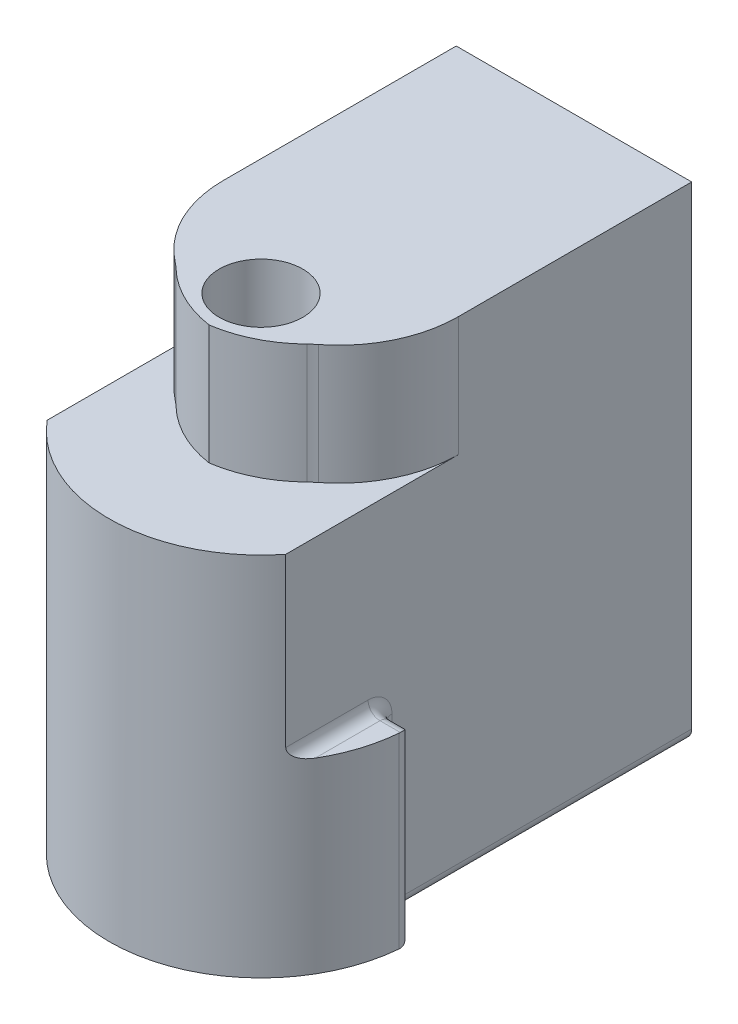
from build123d import *

# Parameters (mm, degrees)
SKETCH2_R                                      = 12.7
BOSS_EXTRUDE6_DEPTH                            = 40.64
SKETCH3_R                                      = 3.5
CUT_EXTRUDE1_DEPTH                             = 40.64
SKETCH4_R                                      = 1.778
CUT_EXTRUDE2_DEPTH                             = 6
BOSS_EXTRUDE8_DEPTH                            = 10
SKETCH8_W                                      = 25.185693912
SKETCH8_H                                      = 10
BOSS_EXTRUDE9_DEPTH                            = 7.284789049
BOSS_EXTRUDE10_DEPTH                           = 30.64
CSK_FOR_M3_FLAT_HEAD_MACHINE_SCREW1_AT_2_COUNT = 2
CSK_FOR_M3_FLAT_HEAD_MACHINE_SCREW1_AT_2_PITCH = 9.039543014
CSK_FOR_M3_FLAT_HEAD_MACHINE_SCREW1_AT_3_COUNT = 2
CSK_FOR_M3_FLAT_HEAD_MACHINE_SCREW1_AT_3_PITCH = 9.039543014
SKETCH16_W                                     = 3.769994858
SKETCH16_H                                     = 22.000968128
CUT_EXTRUDE3_DEPTH                             = 25
SKETCH17_W                                     = 10.276759259
SKETCH17_H                                     = 15.64
CUT_EXTRUDE4_DEPTH                             = 2.743753899
SKETCH18_W                                     = 12.6
SKETCH18_H                                     = 15.64
CUT_EXTRUDE5_DEPTH                             = 2.743753899
SKETCH20_W                                     = 2.743753899
SKETCH20_H                                     = 13.478747573
CUT_EXTRUDE7_DEPTH                             = 25
SKETCH21_W                                     = 5.741451758
SKETCH21_H                                     = 11.696500392
SKETCH21_W_2                                   = 5.938790765
BOSS_EXTRUDE12_DEPTH                           = 15
CUT_EXTRUDE8_START                             = -10
CUT_EXTRUDE8_DEPTH                             = 10
FILLET1_R                                      = 10
FILLET5_R                                      = 10
SKETCH23_W                                     = 2.743753899
SKETCH23_H                                     = 13.478747573
CUT_EXTRUDE9_DEPTH                             = 20
SKETCH24_W                                     = 5.557541457
SKETCH24_H                                     = 9.320824694
SKETCH24_W_2                                   = 5.259690838
BOSS_EXTRUDE13_DEPTH                           = 20
FILLET6_R                                      = 1


with BuildPart() as part:
    # Sketch2 → Boss-Extrude6 (new body)
    with BuildSketch(Plane(origin=(0, -2111.389926236, 0), x_dir=(1, 0, 0), z_dir=(0, 1, 0))):
        with Locations(Location((-53.693967541, 163.840329354, 0), (0, 0, 180))):
            Circle(SKETCH2_R)
    extrude(amount=BOSS_EXTRUDE6_DEPTH)

    # Sketch3 → Cut-Extrude1 (cut)
    with BuildSketch(Plane(origin=(0, -2070.749926236, 0), x_dir=(1, 0, 0), z_dir=(0, 1, 0))):
        with Locations(Location((-53.693967541, 163.840329354, 0), (0, 0, 270))):
            Circle(SKETCH3_R)
    extrude(amount=-CUT_EXTRUDE1_DEPTH, mode=Mode.SUBTRACT)

    # Sketch4 → Cut-Extrude2 (cut)
    with BuildSketch(Plane.XZ.offset(2111.389926236)):
        with Locations(Location((-61.942859512, -159.077829354, 0), (0, 0, 270))):
            Circle(SKETCH4_R)
        with Locations(Location((-53.693967541, -173.365329354, 0), (0, 0, 270))):
            Circle(SKETCH4_R)
        with Locations(Location((-45.44507557, -159.077829354, 0), (0, 0, 270))):
            Circle(SKETCH4_R)
    extrude(amount=-CUT_EXTRUDE2_DEPTH, mode=Mode.SUBTRACT)

    # Sketch7 → Boss-Extrude8 (add)
    with BuildSketch(Plane.XZ.offset(2111.389926236)):
        with BuildLine():
            Line((-40.993967541, -163.840329354), (-40.993967541, -182.634287878))
            Line((-40.993967541, -182.634287878), (-66.179661453, -182.634287878))
            Line((-66.179661453, -182.634287878), (-66.179661453, -166.163570095))
            ThreePointArc((-66.179661453, -166.163570095), (-52.527415502, -176.486639343), (-40.993967541, -163.840329354))
        make_face()
    extrude(amount=-BOSS_EXTRUDE8_DEPTH)

    # Sketch8 → Boss-Extrude9 (add)
    with BuildSketch(Plane(origin=(0, 0, -182.634287878), x_dir=(-1, 0, 0), z_dir=(0, 0, -1))):
        with Locations((53.586814497, -2106.389926236)):
            Rectangle(SKETCH8_W, SKETCH8_H)
    extrude(amount=BOSS_EXTRUDE9_DEPTH)

    # Sketch9 → Boss-Extrude10 (add)
    with BuildSketch(Plane(origin=(0, -2070.749926236, 0), x_dir=(1, 0, 0), z_dir=(0, 1, 0))):
        with BuildLine():
            Line((-66.179661453, 163.840329354), (-66.179661453, 189.919076927))
            Line((-66.179661453, 189.919076927), (-40.993967541, 189.919076927))
            Line((-40.993967541, 189.919076927), (-40.993967541, 163.840329354))
            ThreePointArc((-40.993967541, 163.840329354), (-53.586814497, 176.43317631), (-66.179661453, 163.840329354))
        make_face()
    extrude(amount=-BOSS_EXTRUDE10_DEPTH)

    # Sketch15 → CSK for M3 Flat Head Machine Screw1 (revolve, cut)
    with BuildSketch(Plane(origin=(-53.586814498, -2075.749926236, -189.919076927), x_dir=(0, 1, 0), z_dir=(1, 0, 0))):
        Polygon((0, 0), (0, 10), (1.7, 8.978536948), (1.7, 1.45), (3.15, 0), align=None)
    csk_for_m3_flat_head_machine_screw1 = revolve(axis=Axis((-53.586814498, -2075.749926236, -196.269076927), (0, 0, 1)), mode=Mode.SUBTRACT)

    # CSK for M3 Flat Head Machine Screw1 at 2: CSK for M3 Flat Head Machine Screw1 ×2
    with Locations(*[(-i * CSK_FOR_M3_FLAT_HEAD_MACHINE_SCREW1_AT_2_PITCH, 0, 0) for i in range(1, CSK_FOR_M3_FLAT_HEAD_MACHINE_SCREW1_AT_2_COUNT)]):
        add(csk_for_m3_flat_head_machine_screw1, mode=Mode.SUBTRACT)

    # CSK for M3 Flat Head Machine Screw1 at 3: CSK for M3 Flat Head Machine Screw1 ×2
    with Locations(*[(i * CSK_FOR_M3_FLAT_HEAD_MACHINE_SCREW1_AT_3_PITCH, 0, 0) for i in range(1, CSK_FOR_M3_FLAT_HEAD_MACHINE_SCREW1_AT_3_COUNT)]):
        add(csk_for_m3_flat_head_machine_screw1, mode=Mode.SUBTRACT)

    # Mirror1: CSK for M3 Flat Head Machine Screw1 across plane
    add(csk_for_m3_flat_head_machine_screw1.mirror(Plane.ZX.offset(-2091.069926234)), mode=Mode.SUBTRACT)

    # Mirror1 copy 1 sketch → Mirror1 copy 1 (revolve, cut)
    with BuildSketch(Plane(origin=(-62.626357512, -2106.389926232, -189.919076927), x_dir=(0, -1, 0), z_dir=(1, 0, 0))):
        Polygon((0, 0), (0, -10), (1.7, -8.978536948), (1.7, -1.45), (3.15, 0), align=None)
    revolve(axis=Axis((-62.626357512, -2106.389926232, -196.269076927), (0, 0, -1)), mode=Mode.SUBTRACT)

    # Mirror1 copy 2 sketch → Mirror1 copy 2 (revolve, cut)
    with BuildSketch(Plane(origin=(-44.547271484, -2106.389926232, -189.919076927), x_dir=(0, -1, 0), z_dir=(1, 0, 0))):
        Polygon((0, 0), (0, -10), (1.7, -8.978536948), (1.7, -1.45), (3.15, 0), align=None)
    revolve(axis=Axis((-44.547271484, -2106.389926232, -196.269076927), (0, 0, -1)), mode=Mode.SUBTRACT)

    # Sketch16 → Cut-Extrude3 (cut)
    with BuildSketch(Plane(origin=(0, -2070.749926236, 0), x_dir=(1, 0, 0), z_dir=(0, 1, 0))):
        with Locations((-65.320904983, 165.43984529)):
            Rectangle(SKETCH16_W, SKETCH16_H)
        with Locations((-41.852724011, 165.43984529)):
            Rectangle(SKETCH16_W, SKETCH16_H)
    extrude(amount=-CUT_EXTRUDE3_DEPTH, mode=Mode.SUBTRACT)

    # Sketch17 → Cut-Extrude4 (cut)
    with BuildSketch(Plane.ZY.offset(66.179661453)):
        with Locations((-171.301949724, -2103.569926236)):
            Rectangle(SKETCH17_W, SKETCH17_H)
    extrude(amount=-CUT_EXTRUDE4_DEPTH, mode=Mode.SUBTRACT)

    # Sketch18 → Cut-Extrude5 (cut)
    with BuildSketch(Plane(origin=(-40.993967541, 0, 0), x_dir=(0, 0, -1), z_dir=(1, 0, 0))):
        with Locations((170.140329354, -2103.569926236)):
            Rectangle(SKETCH18_W, SKETCH18_H)
    extrude(amount=-CUT_EXTRUDE5_DEPTH, mode=Mode.SUBTRACT)

    # Sketch20 → Cut-Extrude7 (cut)
    with BuildSketch(Plane(origin=(0, -2070.749926236, 0), x_dir=(1, 0, 0), z_dir=(0, 1, 0))):
        with Locations((-42.365844491, 183.179703141)):
            Rectangle(SKETCH20_W, SKETCH20_H)
        with Locations((-64.807784504, 183.179703141)):
            Rectangle(SKETCH20_W, SKETCH20_H)
    extrude(amount=-CUT_EXTRUDE7_DEPTH, mode=Mode.SUBTRACT)

    # Sketch21 → Boss-Extrude12 (add)
    with BuildSketch(Plane(origin=(0, 0, -189.919076927), x_dir=(-1, 0, 0), z_dir=(0, 0, -1))):
        with Locations((46.608447319, -2076.598176432)):
            Rectangle(SKETCH21_W, SKETCH21_H)
        with Locations((60.466512171, -2076.598176432)):
            Rectangle(SKETCH21_W_2, SKETCH21_H)
    extrude(amount=-BOSS_EXTRUDE12_DEPTH)

    # Sketch22 → Cut-Extrude8 (cut)
    with BuildSketch(Plane(origin=(0, -2070.749926236, 0), x_dir=(1, 0, 0), z_dir=(0, 1, 0)).offset(CUT_EXTRUDE8_START)):
        with BuildLine():
            Line((-49.74995705, 159.255687351), (-53.693967541, 159.255687351))
            Line((-53.693967541, 159.255687351), (-57.324101589, 159.255687351))
            ThreePointArc((-57.324101589, 159.255687351), (-59.615792554, 162.566782678), (-63.435907554, 163.840329354))
            Line((-63.435907554, 163.840329354), (-63.435907554, 159.255687351))
            Line((-63.435907554, 159.255687351), (-63.435907554, 155.692654546))
            ThreePointArc((-63.435907554, 155.692654546), (-53.52421717, 151.141463861), (-43.73772144, 155.95596739))
            Line((-43.73772144, 155.95596739), (-43.73772144, 159.255687351))
            Line((-43.73772144, 159.255687351), (-43.73772144, 163.840329354))
            ThreePointArc((-43.73772144, 163.840329354), (-47.518128803, 162.563400885), (-49.74995705, 159.255687351))
        make_face()
    extrude(amount=CUT_EXTRUDE8_DEPTH, mode=Mode.SUBTRACT)

    # Fillet1
    # the kernel refuses this fillet: 10 mm, written as the material it takes off along each edge
    with BuildSketch(Plane(origin=(-49.74995705, -2080.749926236, -159.255687351), x_dir=(-1, 0, 0), z_dir=(0, 1, 0))) as fillet1_piece_1:
        with BuildLine():
            CenterArc((5.294391522, -10), FILLET1_R, 90, 44.143408643)
            ThreePointArc((-1.670175142, -2.824011483), (-0.645987197, -1.523843369), (0, 0))
            Line((0, 0), (5.294391522, 0))
        make_face()
    extrude(amount=23.235978804, mode=Mode.SUBTRACT)
    with BuildSketch(Plane(origin=(-57.324101589, -2080.749926236, -159.255687351), x_dir=(1, 0, 0), z_dir=(0, 1, 0))) as fillet1_piece_2:
        with BuildLine():
            CenterArc((5.248080135, 10), FILLET1_R, 226.043798631, 43.956201369)
            ThreePointArc((-1.693002689, 2.80129392), (-0.663389254, 1.511313412), (0, 0))
            Line((0, 0), (5.248080135, 0))
        make_face()
    extrude(amount=23.120200338, mode=Mode.SUBTRACT)

    # Fillet5
    fillet5_edges = [part.edges().sort_by_distance(p)[0] for p in [
        (-43.73772144, -2075.749926236, -163.840329354),
        (-63.435907554, -2075.749926236, -163.840329354),
    ]]
    fillet(fillet5_edges, radius=FILLET5_R)

    # Sketch23 → Cut-Extrude9 (cut)
    with BuildSketch(Plane(origin=(0, -2095.749926236, 0), x_dir=(1, 0, 0), z_dir=(0, 1, 0))):
        with Locations((-64.807784504, 183.179703141)):
            Rectangle(SKETCH23_W, SKETCH23_H)
        with Locations((-42.365844491, 183.179703141)):
            Rectangle(SKETCH23_W, SKETCH23_H)
    extrude(amount=-CUT_EXTRUDE9_DEPTH, mode=Mode.SUBTRACT)

    # Sketch24 → Boss-Extrude13 (add)
    with BuildSketch(Plane(origin=(0, 0, -189.919076927), x_dir=(-1, 0, 0), z_dir=(0, 0, -1))):
        with Locations((46.516492169, -2106.729513889)):
            Rectangle(SKETCH24_W, SKETCH24_H)
        with Locations((60.806062135, -2106.729513889)):
            Rectangle(SKETCH24_W_2, SKETCH24_H)
    extrude(amount=-BOSS_EXTRUDE13_DEPTH)

    # Fillet6
    fillet6_edges = [part.edges().sort_by_distance(p)[0] for p in [
        (-63.435907554, -2095.749926236, -160.92811232),
        (-63.435907554, -2111.389926236, -183.17970314),
        (-64.807784503, -2111.389926236, -166.163570095),
        (-63.435907554, -2103.569926236, -166.163570095),
        (-64.807784503, -2095.749926236, -166.163570095),
        (-43.73772144, -2095.749926236, -159.898148372),
        (-42.365844491, -2095.749926236, -163.840329354),
        (-43.73772144, -2103.569926236, -163.840329354),
        (-42.365844491, -2111.389926236, -163.840329354),
        (-43.73772144, -2111.389926236, -183.17970314),
        (-66.179661453, -2103.569926236, -166.163570095),
        (-40.993967541, -2103.569926236, -163.840329354),
    ]]
    fillet(fillet6_edges, radius=FILLET6_R)


solid = part.part
